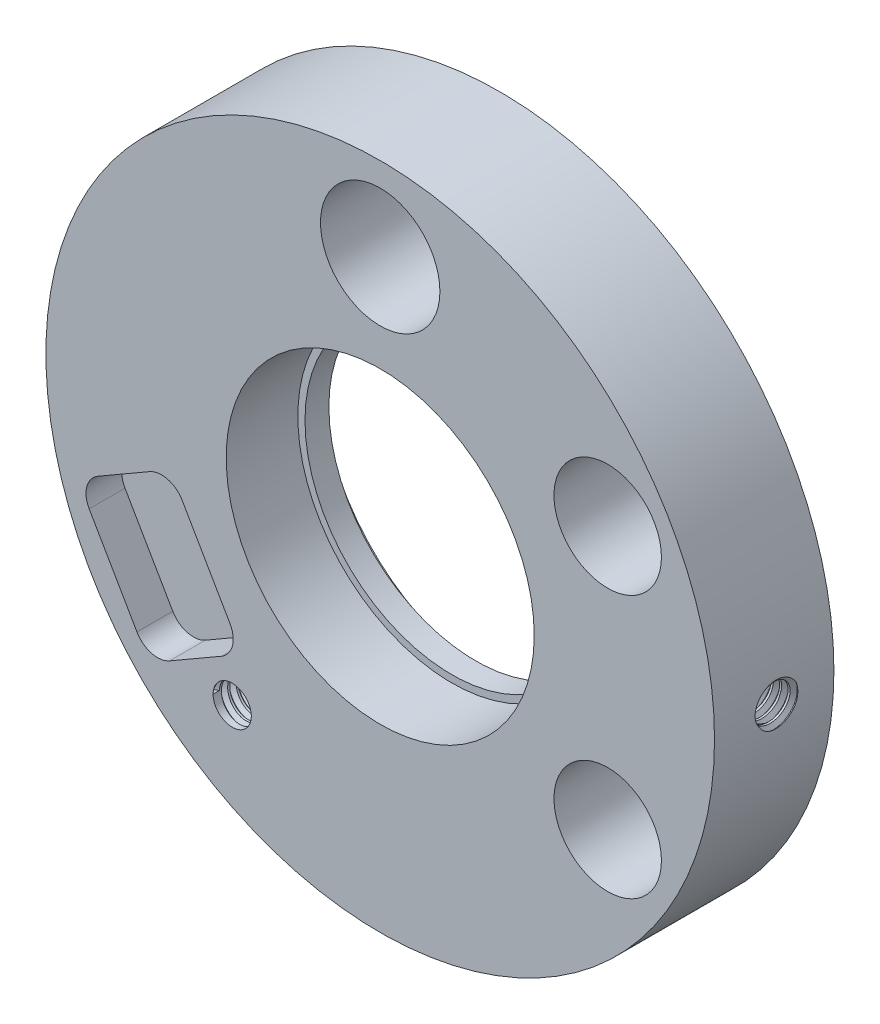
from build123d import *
from build123d.topology import SkipClean

# Parameters (mm, degrees)
SKETCH3_R              = 14
CAVITYUPPER_DEPTH      = 5
SKETCH4_R              = 6.15
TUBECUT_DEPTH          = 21.420577857
SKETCH5_R              = 6.45
TUBECUTEDGE_DEPTH      = 3
SKETCH6_R              = 2.5
WAVEGUIDECUT_DEPTH     = 21.420577857
COILCUT_R              = 7.5
COILEXTRUDECUT_DEPTH   = 1
SKETCH8_R              = 2.25
COAXCUT_DEPTH          = 21.420577857
TEMPSENSORCUT_DEPTH    = 1.5
SKETCH11_R             = 0.8
CUT_EXTRUDE2_DEPTH     = 4
THREAD2_PITCH          = 0.35
CUT_EXTRUDE3_START     = -15
CUT_EXTRUDE3_OUTLINE_R = 0.8
CUT_EXTRUDE3_DEPTH     = 7
THREAD3_PITCH          = 0.35
THREAD4_PITCH          = 0.35


with BuildPart() as part:
    # Sketch3 → CavityUpper (new body)
    with BuildSketch(Plane.XY):
        Circle(SKETCH3_R)
    extrude(amount=CAVITYUPPER_DEPTH)

    # Sketch4 → TubeCut (cut, through all)
    with BuildSketch(Plane.XY.offset(5)):
        Circle(SKETCH4_R)
    extrude(amount=-TUBECUT_DEPTH, mode=Mode.SUBTRACT)

    # Sketch5 → TubeCutEdge (cut)
    with BuildSketch(Plane.XY.offset(5)):
        Circle(SKETCH5_R)
    extrude(amount=-TUBECUTEDGE_DEPTH, mode=Mode.SUBTRACT)

    # Sketch6 → WaveguideCut (cut, through all)
    with BuildSketch(Plane.XY.offset(5)):
        with Locations((0, 10.5)):
            Circle(SKETCH6_R)
    extrude(amount=-WAVEGUIDECUT_DEPTH, mode=Mode.SUBTRACT)

    # CoilCut → CoilExtrudeCut (cut)
    with BuildSketch(Plane.XY):
        Circle(COILCUT_R)
    extrude(amount=COILEXTRUDECUT_DEPTH, mode=Mode.SUBTRACT)

    # Sketch8 → CoaxCut (cut, through all)
    with BuildSketch(Plane.XY.offset(5)):
        with Locations((9.526279442, 5.5)):
            Circle(SKETCH8_R)
        with Locations((9.526279442, -5.5)):
            Circle(SKETCH8_R)
    extrude(amount=-COAXCUT_DEPTH, mode=Mode.SUBTRACT)

    # Sketch10 → TempSensorCut (cut)
    with BuildSketch(Plane.XY.offset(5)):
        with BuildLine():
            Line((-8.820627668, -8.556693374), (-6.655564158, -7.306693374))
            ThreePointArc((-6.655564158, -7.306693374), (-6.189638332, -6.699487015), (-6.289538755, -5.94066797))
            Line((-6.289538755, -5.94066797), (-8.289538755, -2.476566355))
            ThreePointArc((-8.289538755, -2.476566355), (-8.896745113, -2.010640528), (-9.655564158, -2.110540951))
            Line((-9.655564158, -2.110540951), (-11.820627668, -3.360540951))
            ThreePointArc((-11.820627668, -3.360540951), (-12.286553494, -3.96774731), (-12.186653072, -4.726566355))
            Line((-12.186653072, -4.726566355), (-10.186653072, -8.19066797))
            ThreePointArc((-10.186653072, -8.19066797), (-9.579446713, -8.656593796), (-8.820627668, -8.556693374))
        make_face()
    extrude(amount=-TEMPSENSORCUT_DEPTH, mode=Mode.SUBTRACT)

    # Sketch11 → Cut-Extrude2 (cut)
    with BuildSketch(Plane.XY.offset(5)):
        with Locations((-6.198089343, -8.851788941)):
            Circle(SKETCH11_R)
    extrude(amount=-CUT_EXTRUDE2_DEPTH, mode=Mode.SUBTRACT)

    # Thread2: arcs per turn and ends read off the stored shape
    # Thread2: the profile of Thread Profile2 profile screwed along a right-hand helix through 11.428571 turns, 6 arcs to a turn; built about Z, then put on its axis
    with SkipClean():  # the faces are left unmerged after this step: merging them gives an invalid solid
        thread2_z = Axis((0, 0, 0), (0, 0, 1))
        thread2_corners = [(0.7997, 0, -0.000173205), (0.989443056, 0, 0.109375), (0.989443056, 0, 0.153125), (0.7997, 0, 0.262673204)]
        with BuildLine(mode=Mode.PRIVATE) as thread2_profile:
            Line(thread2_corners[0], thread2_corners[1])
            Line(thread2_corners[1], thread2_corners[2])
            Line(thread2_corners[2], thread2_corners[3])
            Line(thread2_corners[3], thread2_corners[0])
        thread2_cap = Face(thread2_profile.wire())
        thread2_turn_angles = [0, 30, 60, 90, 120, 150, 180, 210, 240, 270, 300, 330, 360]
        thread2_turn_weights = [1, 0.8660254037844387, 1, 0.8660254037844387, 1, 0.8660254037844387, 1, 0.8660254037844387, 1, 0.8660254037844387, 1, 0.8660254037844387, 1]
        thread2_turn_rails = [Edge.make_bspline([Vector(p[0], p[1], 0).rotate(thread2_z, thread2_turn_angles[k]) / thread2_turn_weights[k] + Vector(0, 0, p[2] + THREAD2_PITCH * thread2_turn_angles[k] / 360) for k in range(13)], [0, 0, 0, 1, 1, 2, 2, 3, 3, 4, 4, 5, 5, 6, 6, 6], 2, thread2_turn_weights) for p in thread2_corners]
        thread2_turn_sides = [Face.make_surface_from_curves(thread2_turn_rails[p[0]], thread2_turn_rails[p[1]]) for p in [(0, 1), (1, 2), (2, 3), (3, 0)]]
        thread2_last_angles = [3960, 3990, 4020, 4050, 4080, 4097.142857143, 4114.285714286]
        thread2_last_weights = [1, 0.8660254037844387, 1, 0.8660254037844387, 1, 0.9555728057861397, 1]
        thread2_last_rails = [Edge.make_bspline([Vector(p[0], p[1], 0).rotate(thread2_z, thread2_last_angles[k]) / thread2_last_weights[k] + Vector(0, 0, p[2] + THREAD2_PITCH * thread2_last_angles[k] / 360) for k in range(7)], [0, 0, 0, 1, 1, 2, 2, 3, 3, 3], 2, thread2_last_weights) for p in thread2_corners]
        thread2_last_sides = [Face.make_surface_from_curves(thread2_last_rails[p[0]], thread2_last_rails[p[1]]) for p in [(0, 1), (1, 2), (2, 3), (3, 0)]]
        thread2 = Plane(origin=(-6.198089343, -8.851788941, 5), x_dir=(-1, 0, 0), z_dir=(0, 0, -1)) * Solid(Shell([*[p.moved(Location((0, 0, THREAD2_PITCH * i))) for i in range(11) for p in thread2_turn_sides], *thread2_last_sides, thread2_cap, thread2_cap.rotate(thread2_z, 4114.285714286).moved(Location((0, 0, THREAD2_PITCH * 4114.285714286 / 360)))]))
        add(thread2, mode=Mode.SUBTRACT)

    # Cut-Extrude3: read off the stored shape, not the designer's step
    # Cut-Extrude3 outline → Cut-Extrude3 (cut)
    with SkipClean():  # the faces are left unmerged after this step: merging them gives an invalid solid
        with BuildSketch(Plane.YZ.offset(CUT_EXTRUDE3_START)):
            with Locations((0, 2.5)):
                Circle(CUT_EXTRUDE3_OUTLINE_R)
        cut_extrude3 = extrude(amount=CUT_EXTRUDE3_DEPTH, mode=Mode.SUBTRACT)

    # Thread3: arcs per turn and ends read off the stored shape
    # Thread3: the profile of Thread Profile5 profile screwed along a right-hand helix through 20 turns, 6 arcs to a turn; built about Z, then put on its axis
    with SkipClean():  # the faces are left unmerged after this step: merging them gives an invalid solid
        thread3_z = Axis((0, 0, 0), (0, 0, 1))
        thread3_corners = [(0.7997, 0, -0.000173205), (0.989443056, 0, 0.109375), (0.989443056, 0, 0.153125), (0.7997, 0, 0.262673204)]
        with BuildLine(mode=Mode.PRIVATE) as thread3_profile:
            Line(thread3_corners[0], thread3_corners[1])
            Line(thread3_corners[1], thread3_corners[2])
            Line(thread3_corners[2], thread3_corners[3])
            Line(thread3_corners[3], thread3_corners[0])
        thread3_cap = Face(thread3_profile.wire())
        thread3_turn_angles = [0, 30, 60, 90, 120, 150, 180, 210, 240, 270, 300, 330, 360]
        thread3_turn_weights = [1, 0.8660254037844387, 1, 0.8660254037844387, 1, 0.8660254037844387, 1, 0.8660254037844387, 1, 0.8660254037844387, 1, 0.8660254037844387, 1]
        thread3_turn_rails = [Edge.make_bspline([Vector(p[0], p[1], 0).rotate(thread3_z, thread3_turn_angles[k]) / thread3_turn_weights[k] + Vector(0, 0, p[2] + THREAD3_PITCH * thread3_turn_angles[k] / 360) for k in range(13)], [0, 0, 0, 1, 1, 2, 2, 3, 3, 4, 4, 5, 5, 6, 6, 6], 2, thread3_turn_weights) for p in thread3_corners]
        thread3_turn_sides = [Face.make_surface_from_curves(thread3_turn_rails[p[0]], thread3_turn_rails[p[1]]) for p in [(0, 1), (1, 2), (2, 3), (3, 0)]]
        thread3 = Plane(origin=(-15, 0, 2.5), x_dir=(0, 0, -1), z_dir=(1, 0, 0)) * Solid(Shell([*[p.moved(Location((0, 0, THREAD3_PITCH * i))) for i in range(20) for p in thread3_turn_sides], thread3_cap, thread3_cap.rotate(thread3_z, 7200).moved(Location((0, 0, THREAD3_PITCH * 7200 / 360)))]))
        add(thread3, mode=Mode.SUBTRACT)

    # Mirror5: Cut-Extrude3 across plane
    with SkipClean():  # the faces are left unmerged after this step: merging them gives an invalid solid
        add(cut_extrude3.mirror(Plane(origin=(0, 0, 0), x_dir=(0, 0, 1), z_dir=(1, 0, 0))), mode=Mode.SUBTRACT)

    # Thread4: arcs per turn and ends read off the stored shape
    # Thread4: the profile of Thread Profile6 profile screwed along a right-hand helix through 20 turns, 6 arcs to a turn; built about Z, then put on its axis
    with SkipClean():  # the faces are left unmerged after this step: merging them gives an invalid solid
        thread4_z = Axis((0, 0, 0), (0, 0, 1))
        thread4_corners = [(0.7997, 0, -0.000173205), (0.989443056, 0, 0.109375), (0.989443056, 0, 0.153125), (0.7997, 0, 0.262673204)]
        with BuildLine(mode=Mode.PRIVATE) as thread4_profile:
            Line(thread4_corners[0], thread4_corners[1])
            Line(thread4_corners[1], thread4_corners[2])
            Line(thread4_corners[2], thread4_corners[3])
            Line(thread4_corners[3], thread4_corners[0])
        thread4_cap = Face(thread4_profile.wire())
        thread4_turn_angles = [0, 30, 60, 90, 120, 150, 180, 210, 240, 270, 300, 330, 360]
        thread4_turn_weights = [1, 0.8660254037844387, 1, 0.8660254037844387, 1, 0.8660254037844387, 1, 0.8660254037844387, 1, 0.8660254037844387, 1, 0.8660254037844387, 1]
        thread4_turn_rails = [Edge.make_bspline([Vector(p[0], p[1], 0).rotate(thread4_z, thread4_turn_angles[k]) / thread4_turn_weights[k] + Vector(0, 0, p[2] + THREAD4_PITCH * thread4_turn_angles[k] / 360) for k in range(13)], [0, 0, 0, 1, 1, 2, 2, 3, 3, 4, 4, 5, 5, 6, 6, 6], 2, thread4_turn_weights) for p in thread4_corners]
        thread4_turn_sides = [Face.make_surface_from_curves(thread4_turn_rails[p[0]], thread4_turn_rails[p[1]]) for p in [(0, 1), (1, 2), (2, 3), (3, 0)]]
        thread4 = Plane(origin=(15, 0, 2.5), x_dir=(0, 0, 1), z_dir=(-1, 0, 0)) * Solid(Shell([*[p.moved(Location((0, 0, THREAD4_PITCH * i))) for i in range(20) for p in thread4_turn_sides], thread4_cap, thread4_cap.rotate(thread4_z, 7200).moved(Location((0, 0, THREAD4_PITCH * 7200 / 360)))]))
        add(thread4, mode=Mode.SUBTRACT)


solid = part.part
